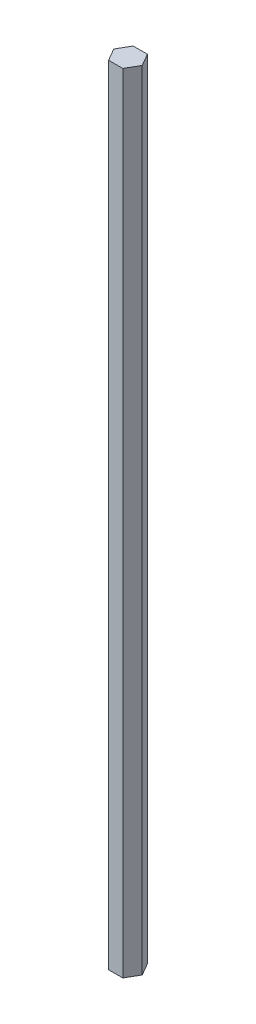
from build123d import *

# Parameters (mm, degrees)
BOSS_EXTRUDE1_DEPTH = 203.2


with BuildPart() as part:
    # Sketch1 → Boss-Extrude1 (new, symmetric)
    with BuildSketch(Plane(origin=(0, 0, 0), x_dir=(1, 0, 0), z_dir=(0, 1, 0))):
        Polygon((7.332348419, 0), (3.666174209, 6.35), (-3.666174209, 6.35), (-7.332348419, 0), (-3.666174209, -6.35), (3.666174209, -6.35), align=None)
    extrude(amount=BOSS_EXTRUDE1_DEPTH, both=True)


solid = part.part
